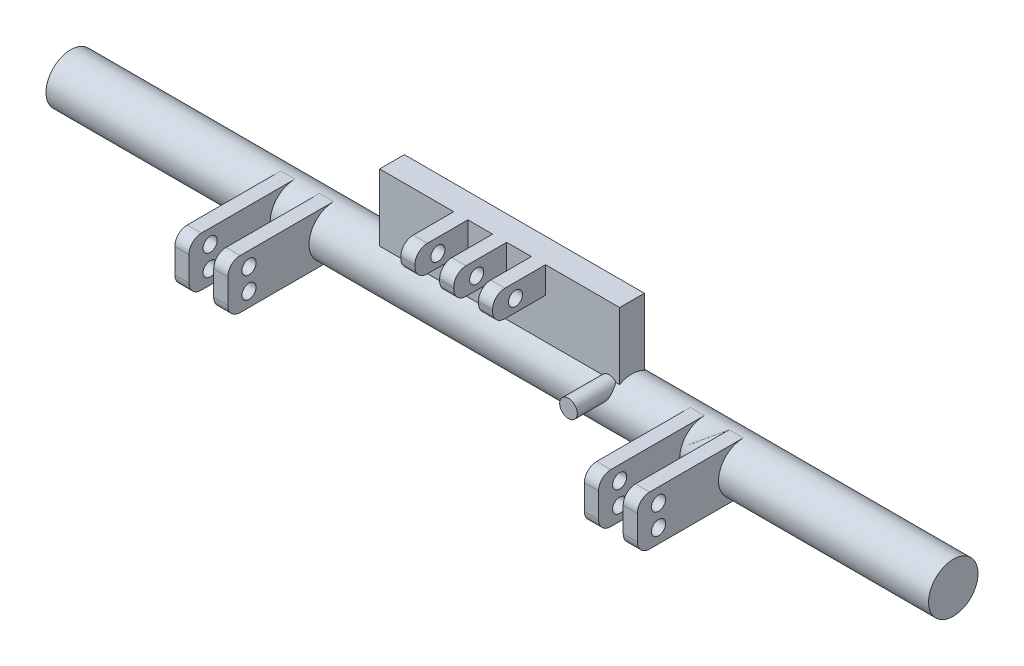
from build123d import *

# Parameters (mm, degrees)
SKETCH1_W               = 250
SKETCH1_H               = 7
SKETCH2_W               = 68
SKETCH2_H               = 7
BOSS_EXTRUDE1_DEPTH     = 25
SKETCH3_W               = 4
SKETCH3_H               = 7.5
BOSS_EXTRUDE2_DEPTH     = 15
FILLET1_R               = 3.5
SKETCH5_R               = 2.5
SKETCH5_W               = 4
SKETCH5_H               = 14
BOSS_EXTRUDE3_DEPTH     = 30
FILLET2_R               = 3.5
CUT_EXTRUDE1_DEPTH      = 195.461435879
CUT_EXTRUDE1_DEPTH_BACK = 195.461435879
SKETCH6_R               = 2
SKETCH4_R               = 2
CUT_EXTRUDE2_DEPTH      = 144.418966785
CUT_EXTRUDE3_START      = -15
SKETCH7_R               = 2.5
CUT_EXTRUDE3_DEPTH      = 15


with BuildPart() as part:
    # Sketch1 → Revolve-Thin1 (revolve)
    with BuildSketch(Plane.XY):
        with Locations((0, 3.5)):
            Rectangle(SKETCH1_W, SKETCH1_H)
    revolve(axis=Axis((-125, 0, 0), (1, 0, 0)))

    # Sketch2 → Boss-Extrude1 (add)
    with BuildSketch(Plane(origin=(0, 0, 0), x_dir=(1, 0, 0), z_dir=(0, 1, 0))):
        Rectangle(SKETCH2_W, SKETCH2_H)
    extrude(amount=BOSS_EXTRUDE1_DEPTH)

    # Sketch3 → Boss-Extrude2 (add)
    with BuildSketch(Plane.XY.offset(3.5)):
        with Locations((-11, 21.25)):
            Rectangle(SKETCH3_W, SKETCH3_H)
        with Locations((0, 21.25)):
            Rectangle(SKETCH3_W, SKETCH3_H)
        with Locations((11, 21.25)):
            Rectangle(SKETCH3_W, SKETCH3_H)
    extrude(amount=BOSS_EXTRUDE2_DEPTH)

    # Fillet1
    fillet1_edges = [part.edges().sort_by_distance(p)[0] for p in [
        (-11, 17.5, 18.5),
        (-11, 25, 18.5),
        (11, 17.5, 18.5),
        (11, 25, 18.5),
        (0, 17.5, 18.5),
        (0, 25, 18.5),
    ]]
    fillet(fillet1_edges, radius=FILLET1_R)

    # Sketch5 → Boss-Extrude3 (add)
    with BuildSketch(Plane.XY):
        with Locations((31, 4.5)):
            Circle(SKETCH5_R)
        with Locations((-52.5, 0)):
            Rectangle(SKETCH5_W, SKETCH5_H)
        with Locations((-63.5, 0)):
            Rectangle(SKETCH5_W, SKETCH5_H)
        with Locations((63.5, 0)):
            Rectangle(SKETCH5_W, SKETCH5_H)
        with Locations((52.5, 0)):
            Rectangle(SKETCH5_W, SKETCH5_H)
    extrude(amount=BOSS_EXTRUDE3_DEPTH)

    # Fillet2
    fillet2_edges = [part.edges().sort_by_distance(p)[0] for p in [
        (63.5, -7, 30),
        (52.5, -7, 30),
        (52.5, 7, 30),
        (63.5, 7, 30),
        (-52.5, -7, 30),
        (-63.5, -7, 30),
        (-52.5, 7, 30),
        (-63.5, 7, 30),
    ]]
    fillet(fillet2_edges, radius=FILLET2_R)

    # Sketch6 → Cut-Extrude1 (cut, two sides: drawn at the far end of the back side and taken through both)
    with BuildSketch(Plane.ZY.offset(65.5).offset(-CUT_EXTRUDE1_DEPTH_BACK)):
        with Locations((24, 3)):
            Circle(SKETCH6_R)
        with Locations((24, -3)):
            Circle(SKETCH6_R)
    extrude(amount=CUT_EXTRUDE1_DEPTH + CUT_EXTRUDE1_DEPTH_BACK, mode=Mode.SUBTRACT)

    # Sketch4 → Cut-Extrude2 (cut, through all)
    with BuildSketch(Plane.ZY.offset(13)):
        with Locations((12, 21)):
            Circle(SKETCH4_R)
    extrude(amount=-CUT_EXTRUDE2_DEPTH, mode=Mode.SUBTRACT)

    # Sketch7 → Cut-Extrude3 (cut)
    with BuildSketch(Plane.XY.offset(30).offset(CUT_EXTRUDE3_START)):
        with Locations((31, 4.5)):
            Circle(SKETCH7_R)
    extrude(amount=CUT_EXTRUDE3_DEPTH, mode=Mode.SUBTRACT)


solid = part.part
